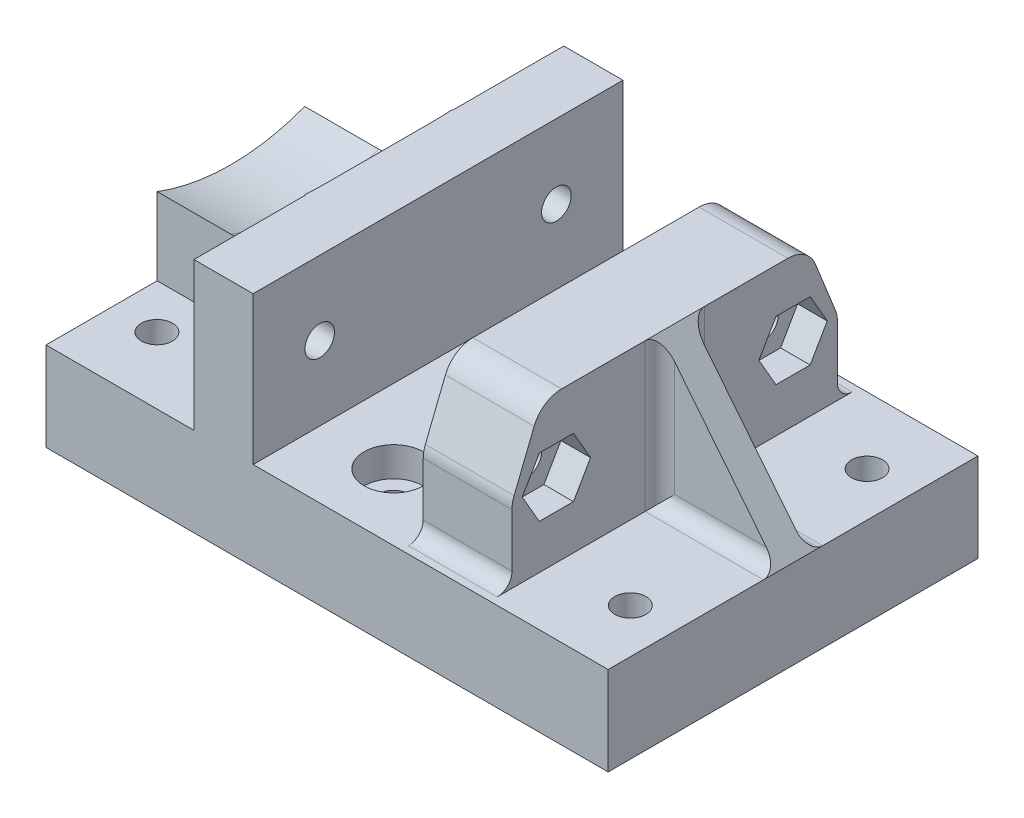
from build123d import *

# Parameters (mm, degrees)
SKETCH1_R           = 1.05
BOSS_EXTRUDE1_DEPTH = 6
SKETCH2_W           = 14
SKETCH2_H           = 25
SKETCH2_W_2         = 6
SKETCH2_H_2         = 22
BOSS_EXTRUDE2_DEPTH = 10
FILLET1_R           = 1
CUT_EXTRUDE2_START  = -6
CUT_EXTRUDE2_DEPTH  = 6
FILLET2_R           = 2
CUT_EXTRUDE3_DEPTH  = 2
CUT_EXTRUDE4_REACH  = 36.587
SKETCH9_R           = 1
BOSS_EXTRUDE3_DEPTH = 1
FILLET3_R           = 1
SKETCH13_R          = 2
CUT_EXTRUDE5_DEPTH  = 2
CUT_EXTRUDE6_DEPTH  = 10
SKETCH15_R          = 1
CUT_EXTRUDE7_DEPTH  = 32.436443819
FILLET4_R           = 5


with BuildPart() as part:
    # Sketch1 → Boss-Extrude1 (new body)
    with BuildSketch(Plane(origin=(0, 0, 0), x_dir=(1, 0, 0), z_dir=(0, 1, 0))):
        Polygon((19, -4.5), (19, 5), (19, 12.5), (-19, 12.5), (-19, 5), (-19, -4.5), (-19, -5), (-19, -12.5), (19, -12.5), (19, -5), align=None)
        with Locations(Location((16, -8, 0), (0, 0, 270))):
            Circle(SKETCH1_R, mode=Mode.SUBTRACT)
        with Locations(Location((0, -8, 0), (0, 0, 270))):
            Circle(SKETCH1_R, mode=Mode.SUBTRACT)
        with Locations(Location((16, 8, 0), (0, 0, 270))):
            Circle(SKETCH1_R, mode=Mode.SUBTRACT)
        with Locations(Location((0, 8, 0), (0, 0, 270))):
            Circle(SKETCH1_R, mode=Mode.SUBTRACT)
        with Locations(Location((-16, -8, 0), (0, 0, 270))):
            Circle(SKETCH1_R, mode=Mode.SUBTRACT)
        with Locations(Location((-16, 8, 0), (0, 0, 270))):
            Circle(SKETCH1_R, mode=Mode.SUBTRACT)
    extrude(amount=BOSS_EXTRUDE1_DEPTH)

    # Sketch2 → Boss-Extrude2 (add)
    with BuildSketch(Plane(origin=(0, 6, 0), x_dir=(1, 0, 0), z_dir=(0, 1, 0))):
        with Locations((-12, 0)):
            Rectangle(SKETCH2_W, SKETCH2_H)
        with Locations((8, 0)):
            Rectangle(SKETCH2_W_2, SKETCH2_H_2)
    extrude(amount=BOSS_EXTRUDE2_DEPTH)

    # Fillet1
    fillet1_edges = [part.edges().sort_by_distance(p)[0] for p in [
        (8, 6, -11),
        (8, 6, 11),
    ]]
    fillet(fillet1_edges, radius=FILLET1_R)

    # Sketch7 → Cut-Extrude2 (cut)
    with BuildSketch(Plane(origin=(11, 0, 0), x_dir=(0, 0, -1), z_dir=(1, 0, 0)).offset(CUT_EXTRUDE2_START)):
        Polygon((-11, 11), (-9, 16), (9, 16), (11, 11), (15.487403983, 11), (15.487403983, 19.998448993), (-12.222391387, 19.998448993), (-12.222391387, 11), align=None)
    extrude(amount=CUT_EXTRUDE2_DEPTH, mode=Mode.SUBTRACT)

    # Fillet2
    fillet2_edges = [part.edges().sort_by_distance(p)[0] for p in [
        (8, 11, 11),
        (8, 16, 9),
        (8, 16, -9),
        (8, 11, -11),
    ]]
    fillet(fillet2_edges, radius=FILLET2_R)

    # Sketch8 → Cut-Extrude3 (cut)
    with BuildSketch(Plane(origin=(11, 0, 0), x_dir=(0, 0, -1), z_dir=(1, 0, 0))):
        Polygon((-5.690598923, 11), (-6.845299462, 13), (-9.154700538, 13), (-10.309401077, 11), (-9.154700538, 9), (-6.845299462, 9), align=None)
    cut_extrude3 = extrude(amount=-CUT_EXTRUDE3_DEPTH, mode=Mode.SUBTRACT)

    # Sketch9 → Cut-Extrude4 (cut, up to next)
    with BuildSketch(Plane(origin=(9, 0, 0), x_dir=(0, 0, -1), z_dir=(1, 0, 0)), mode=Mode.PRIVATE) as cut_extrude4_sk1:
        with Locations((-8, 11)):
            Circle(SKETCH9_R)
    cut_extrude4_tool1 = extrude(cut_extrude4_sk1.sketch, amount=-CUT_EXTRUDE4_REACH, mode=Mode.PRIVATE) & part.part
    cut_extrude4 = cut_extrude4_tool1.solids().sort_by_distance((9, 11, 8))[0]
    add(cut_extrude4, mode=Mode.SUBTRACT)

    # Mirror1: Cut-Extrude3, Cut-Extrude4 across plane
    add(cut_extrude3.mirror(Plane.XY), mode=Mode.SUBTRACT)
    add(cut_extrude4.mirror(Plane.XY), mode=Mode.SUBTRACT)

    # Sketch11 → Boss-Extrude3 (add, symmetric)
    with BuildSketch(Plane.XY):
        Polygon((19, 6), (11, 16), (11, 6), align=None)
    extrude(amount=BOSS_EXTRUDE3_DEPTH, both=True)

    # Fillet3
    # the kernel refuses this fillet: 1 mm, written as the material it adds along each edge
    with BuildSketch(Plane(origin=(8.5, 6, 1), x_dir=(0, 1, 0), z_dir=(1, 0, 0))) as fillet3_piece_1_section:
        with BuildLine():
            CenterArc((FILLET3_R, FILLET3_R), FILLET3_R, 180, 90)
            Line((0, FILLET3_R), (0, 0))
            Line((0, 0), (FILLET3_R, 0))
        make_face()
    fillet3_piece_1 = extrude(amount=10.5, mode=Mode.PRIVATE)
    fillet3_piece_1 = split(fillet3_piece_1, bisect_by=Plane(origin=(15.279807261, 10.650240923, 1.226395114), z_dir=(-0.7808688094430304, -0.6246950475544243, 0)), keep=Keep.TOP, mode=Mode.PRIVATE)
    add(fillet3_piece_1)
    with BuildSketch(Plane(origin=(11, 16, 1), x_dir=(0, 0, 1), z_dir=(0, -1, 0))) as fillet3_piece_2_section:
        with BuildLine():
            CenterArc((FILLET3_R, -FILLET3_R), FILLET3_R, 90, 90)
            Line((0, -FILLET3_R), (0, 0))
            Line((0, 0), (FILLET3_R, 0))
        make_face()
    fillet3_piece_2 = extrude(amount=12.5, mode=Mode.PRIVATE)
    fillet3_piece_2 = split(fillet3_piece_2, bisect_by=Plane(origin=(13.592508379, 12.759364526, 1.22990039), z_dir=(-0.7808688094430304, -0.6246950475544243, 0)), keep=Keep.TOP, mode=Mode.PRIVATE)
    add(fillet3_piece_2)
    with BuildSketch(Plane(origin=(8.5, 6, -1), x_dir=(0, 0, -1), z_dir=(1, 0, 0))) as fillet3_piece_3_section:
        with BuildLine():
            CenterArc((FILLET3_R, FILLET3_R), FILLET3_R, 180, 90)
            Line((0, FILLET3_R), (0, 0))
            Line((0, 0), (FILLET3_R, 0))
        make_face()
    fillet3_piece_3 = extrude(amount=10.5, mode=Mode.PRIVATE)
    fillet3_piece_3 = split(fillet3_piece_3, bisect_by=Plane(origin=(15.279807261, 10.650240923, -1.226395114), z_dir=(-0.7808688094430304, -0.6246950475544243, 0)), keep=Keep.TOP, mode=Mode.PRIVATE)
    add(fillet3_piece_3)
    with BuildSketch(Plane(origin=(11, 16, -1), x_dir=(0, 0, -1), z_dir=(0, -1, 0))) as fillet3_piece_4_section:
        with BuildLine():
            CenterArc((FILLET3_R, FILLET3_R), FILLET3_R, 180, 90)
            Line((0, FILLET3_R), (0, 0))
            Line((0, 0), (FILLET3_R, 0))
        make_face()
    fillet3_piece_4 = extrude(amount=12.5, mode=Mode.PRIVATE)
    fillet3_piece_4 = split(fillet3_piece_4, bisect_by=Plane(origin=(13.592508379, 12.759364526, -1.22990039), z_dir=(-0.7808688094430304, -0.6246950475544243, 0)), keep=Keep.TOP, mode=Mode.PRIVATE)
    add(fillet3_piece_4)

    # Sketch13 → Cut-Extrude5 (cut)
    with BuildSketch(Plane(origin=(0, 6, 0), x_dir=(1, 0, 0), z_dir=(0, 1, 0))):
        with Locations(Location((0, -8, 0), (0, 0, 270))):
            Circle(SKETCH13_R)
        with Locations(Location((0, 8, 0), (0, 0, 270))):
            Circle(SKETCH13_R)
    extrude(amount=-CUT_EXTRUDE5_DEPTH, mode=Mode.SUBTRACT)

    # Sketch14 → Cut-Extrude6 (cut)
    with BuildSketch(Plane.ZY.offset(19)):
        with BuildLine():
            Line((-4.987800212, 11.218644984), (-4.987800212, 6))
            Line((-4.987800212, 6), (-16.528108282, 6))
            Line((-16.528108282, 6), (-16.528108282, 44.040536724))
            Line((-16.528108282, 44.040536724), (16.528108282, 44.040536724))
            Line((16.528108282, 44.040536724), (16.528108282, 6))
            Line((16.528108282, 6), (4.987800212, 6))
            Line((4.987800212, 6), (4.987800212, 11.218644984))
            ThreePointArc((4.987800212, 11.218644984), (0, 10.3), (-4.987800212, 11.218644984))
        make_face()
    extrude(amount=-CUT_EXTRUDE6_DEPTH, mode=Mode.SUBTRACT)

    # Sketch15 → Cut-Extrude7 (cut, through all)
    with BuildSketch(Plane(origin=(-5, 0, 0), x_dir=(0, 0, -1), z_dir=(1, 0, 0))):
        with Locations((-8, 11)):
            Circle(SKETCH15_R)
        with Locations((8, 11)):
            Circle(SKETCH15_R)
    extrude(amount=-CUT_EXTRUDE7_DEPTH, mode=Mode.SUBTRACT)

    # Fillet4
    # the kernel refuses this fillet: 5 mm, written as the material it adds along each edge
    with BuildSketch(Plane(origin=(-9, 24.3, 0), x_dir=(0, -0.30847325638563394, 0.9512330156669516), z_dir=(0, 0.9512330156669516, 0.30847325638563394))) as fillet4_piece_1_section:
        with BuildLine():
            CenterArc((14 - FILLET4_R, -FILLET4_R), FILLET4_R, 0, 90)
            Line((14, -FILLET4_R), (14, 0))
            Line((14, 0), (14 - FILLET4_R, 0))
        make_face()
    fillet4_piece_1 = revolve(axis=Axis((-9, 24.3, 0), (1, 0, 0)), revolution_arc=144.065508201, mode=Mode.PRIVATE)
    fillet4_piece_1 = split(fillet4_piece_1, bisect_by=Plane(origin=(-10.130683899, 16, -3.44e-07), z_dir=(0, -1, 0)), keep=Keep.TOP, mode=Mode.PRIVATE)
    fillet4_piece_1 = split(fillet4_piece_1, bisect_by=Plane(origin=(-10.130683899, 11.770838436, 4.987800212), z_dir=(0, 0, -1)), keep=Keep.TOP, mode=Mode.PRIVATE)
    fillet4_piece_1 = split(fillet4_piece_1, bisect_by=Plane(origin=(-10.130683899, 11.770838436, -4.987800212), z_dir=(0, 0, 1)), keep=Keep.TOP, mode=Mode.PRIVATE)
    add(fillet4_piece_1)


solid = part.part
